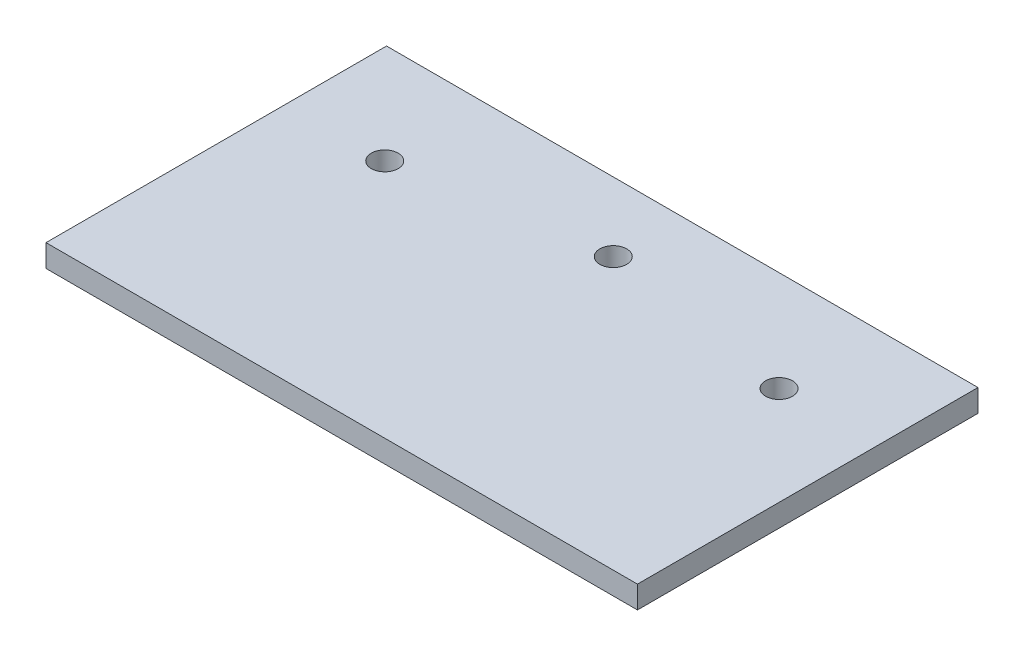
from build123d import *

# Parameters (mm, degrees)
SKETCH1_W           = 66
SKETCH1_H           = 38
BOSS_EXTRUDE1_DEPTH = 2.5
SKETCH2_R           = 1.5
CUT_EXTRUDE1_DEPTH  = 77.198753271


with BuildPart() as part:
    # Sketch1 → Boss-Extrude1 (new body)
    with BuildSketch(Plane(origin=(0, 0, 0), x_dir=(1, 0, 0), z_dir=(0, 1, 0))):
        with Locations((33, 19)):
            Rectangle(SKETCH1_W, SKETCH1_H)
    extrude(amount=BOSS_EXTRUDE1_DEPTH)

    # Sketch2 → Cut-Extrude1 (cut, through all)
    with BuildSketch(Plane.XZ):
        with Locations((33, -30.3)):
            Circle(SKETCH2_R)
        with Locations((11, -26.8)):
            Circle(SKETCH2_R)
        with Locations((55, -26.8)):
            Circle(SKETCH2_R)
    extrude(amount=-CUT_EXTRUDE1_DEPTH, mode=Mode.SUBTRACT)


solid = part.part
